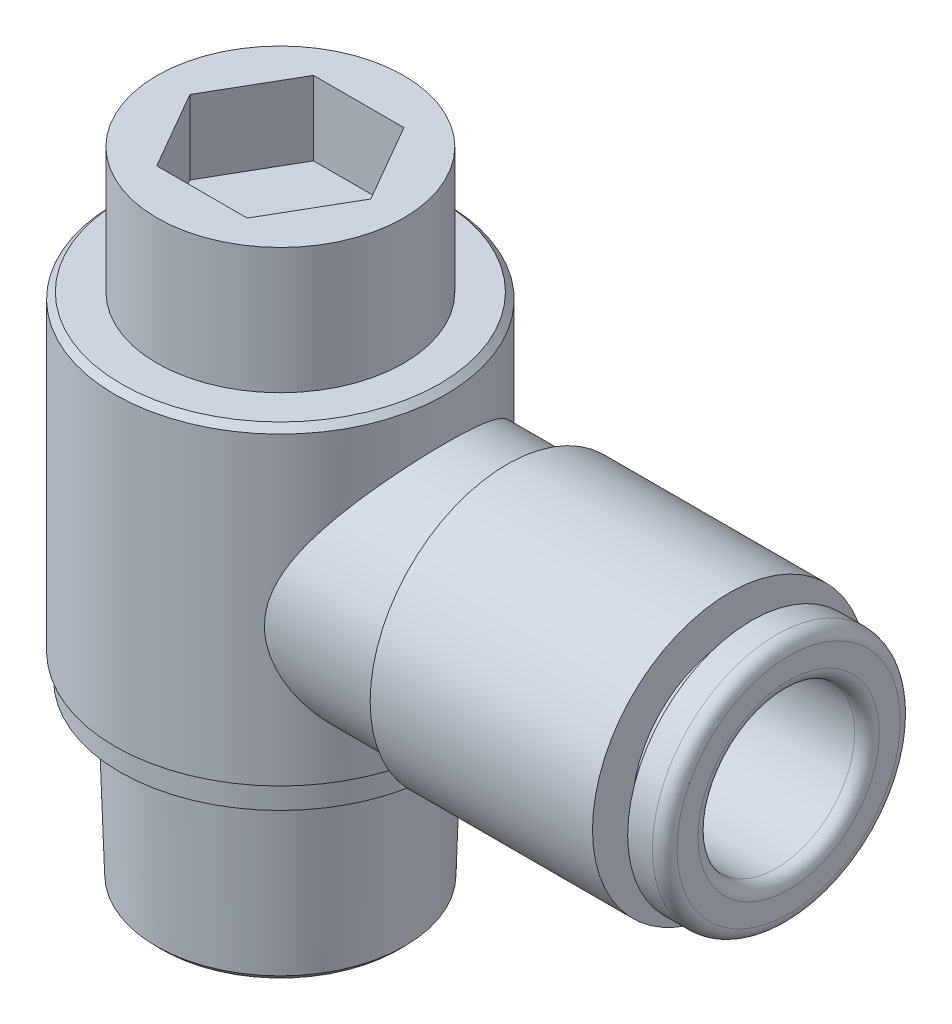
from build123d import *

# Parameters (mm, degrees)
CBODY_DEPTH            = 7
CBODY_DEPTH_BACK       = 5.6
CBODY_SKETCH_R         = 6.7
CBODY_CHAMFER_SIZE     = 0.25
THREAD_OFFSET_SKETCH_R = 6.5
THREAD_OFFSET_DEPTH    = 1
HEAD_SKETCH_R          = 5
HEAD_DEPTH             = 5.1
HEX_2_DEPTH            = 3
TUBE_START             = -13.3
TUBE_SKETCH_R          = 3.175
TUBE_DEPTH             = 13.3
TUBE_FILLET_R          = 0.5
PROFILE_PORT_R         = 1.5875


with BuildPart() as part:
    # CBody_Sketch → CBody (new, two sides: drawn at the far end of the back side and taken through both)
    with BuildSketch(Plane(origin=(0, 0, 0), x_dir=(1, 0, 0), z_dir=(0, 1, 0)).offset(-CBODY_DEPTH_BACK)):
        with Locations(Location((0, 0, 0), (0, 0, 270))):
            Circle(CBODY_SKETCH_R)
    extrude(amount=CBODY_DEPTH + CBODY_DEPTH_BACK)

    # CBody_Chamfer
    cbody_chamfer_edges = [part.edges().sort_by_distance(p)[0] for p in [
        (0, 7, -6.7),
    ]]
    chamfer(cbody_chamfer_edges, length=CBODY_CHAMFER_SIZE)

    # Thread_Offset_Sketch → Thread_Offset (add)
    with BuildSketch(Plane(origin=(0, -5.6, 0), x_dir=(-1, 0, 0), z_dir=(0, 1, 0))):
        with Locations(Location((0, 0, 0), (0, 0, 90))):
            Circle(THREAD_OFFSET_SKETCH_R)
    extrude(amount=-THREAD_OFFSET_DEPTH)

    # Thread_Sketch → Thread (revolve)
    with BuildSketch(Plane.XY, mode=Mode.PRIVATE) as thread_sk:
        Polygon((-5.24727057, -6.6), (-5.026624869, -13.7), (0, -13.7), (0, -6.6), align=None)
    revolve(thread_sk.sketch.rotate(Axis((0, 0, 0), (0, -1, 0)), 270), axis=Axis((0, 0, 0), (0, -1, 0)))

    # Thread_Chamfer: read off the stored shape, not the designer's step
    # Thread_Chamfer outline → Thread_Chamfer (revolve, cut)
    with BuildSketch(Plane.XY):
        Polygon((5.03464327, -13.441981598), (4.776624869, -13.7), (5.03464327, -13.7), align=None)
    revolve(axis=Axis((0, 0, 0), (0, 1, 0)), mode=Mode.SUBTRACT)

    # Head_Sketch → Head (add)
    with BuildSketch(Plane(origin=(0, 7, 0), x_dir=(-1, 0, 0), z_dir=(0, 1, 0))):
        with Locations(Location((0, 0, 0), (0, 0, 90))):
            Circle(HEAD_SKETCH_R)
    extrude(amount=HEAD_DEPTH)

    # Hex_Sketch → Hex 2 (cut)
    with BuildSketch(Plane(origin=(0, 12.1, 0), x_dir=(-1, 0, 0), z_dir=(0, 1, 0))):
        Polygon((-1.833087105, 3.175), (-3.666174209, 0), (-1.833087105, -3.175), (1.833087105, -3.175), (3.666174209, 0), (1.833087105, 3.175), align=None)
    extrude(amount=-HEX_2_DEPTH, mode=Mode.SUBTRACT)

    # RBody_Sketch → RBody (revolve)
    with BuildSketch(Plane(origin=(0, 0, 0), x_dir=(1, 0, 0), z_dir=(0, 1, 0))):
        Polygon((0, 0), (2.915618859, -5.05), (8.9, -5.05), (9.188675135, -5.55), (18.2, -5.55), (18.2, 0), align=None)
    revolve(axis=Axis((-16.33553342, 0, 0), (1, 0, 0)))

    # Release_Sketch → Release (revolve)
    with BuildSketch(Plane(origin=(0, 0, 0), x_dir=(1, 0, 0), z_dir=(0, 1, 0)), mode=Mode.PRIVATE) as release_sk:
        with BuildLine():
            Line((18.2, 0), (18.2, 3.925))
            Line((18.2, 3.925), (19.1, 3.925))
            Line((19.1, 3.925), (19.1, 5.025))
            Line((19.1, 5.025), (20.1, 5.025))
            ThreePointArc((20.1, 5.025), (20.453553391, 4.878553391), (20.6, 4.525))
            Line((20.6, 4.525), (20.6, 0))
            Line((20.6, 0), (18.2, 0))
        make_face()
    revolve(release_sk.sketch.rotate(Axis((0, 0, 0), (1, 0, 0)), 180), axis=Axis((0, 0, 0), (1, 0, 0)))

    # Tube_Sketch → Tube (cut)
    with BuildSketch(Plane(origin=(20.6, 0, 0), x_dir=(0, 0, -1), z_dir=(1, 0, 0)).offset(TUBE_START)):
        Circle(TUBE_SKETCH_R)
    extrude(amount=TUBE_DEPTH, mode=Mode.SUBTRACT)

    # Tube_Fillet
    tube_fillet_edges = [part.edges().sort_by_distance(p)[0] for p in [
        (20.6, 0, 3.175),
    ]]
    fillet(tube_fillet_edges, radius=TUBE_FILLET_R)

    # Port: sweep along a path in Path Port
    with BuildLine(Plane.XY) as port_path:
        Line((20.6, 0), (2, 0))
        ThreePointArc((2, 0), (0.585786438, -0.585786438), (0, -2))
        Line((0, -2), (0, -13.7))
    # Profile Port → Port (sweep, cut)
    with BuildSketch(Plane(origin=(20.6, 0, 0), x_dir=(0, 0, -1), z_dir=(1, 0, 0))):
        Circle(PROFILE_PORT_R)
    sweep(path=port_path.line, mode=Mode.SUBTRACT)


solid = part.part
